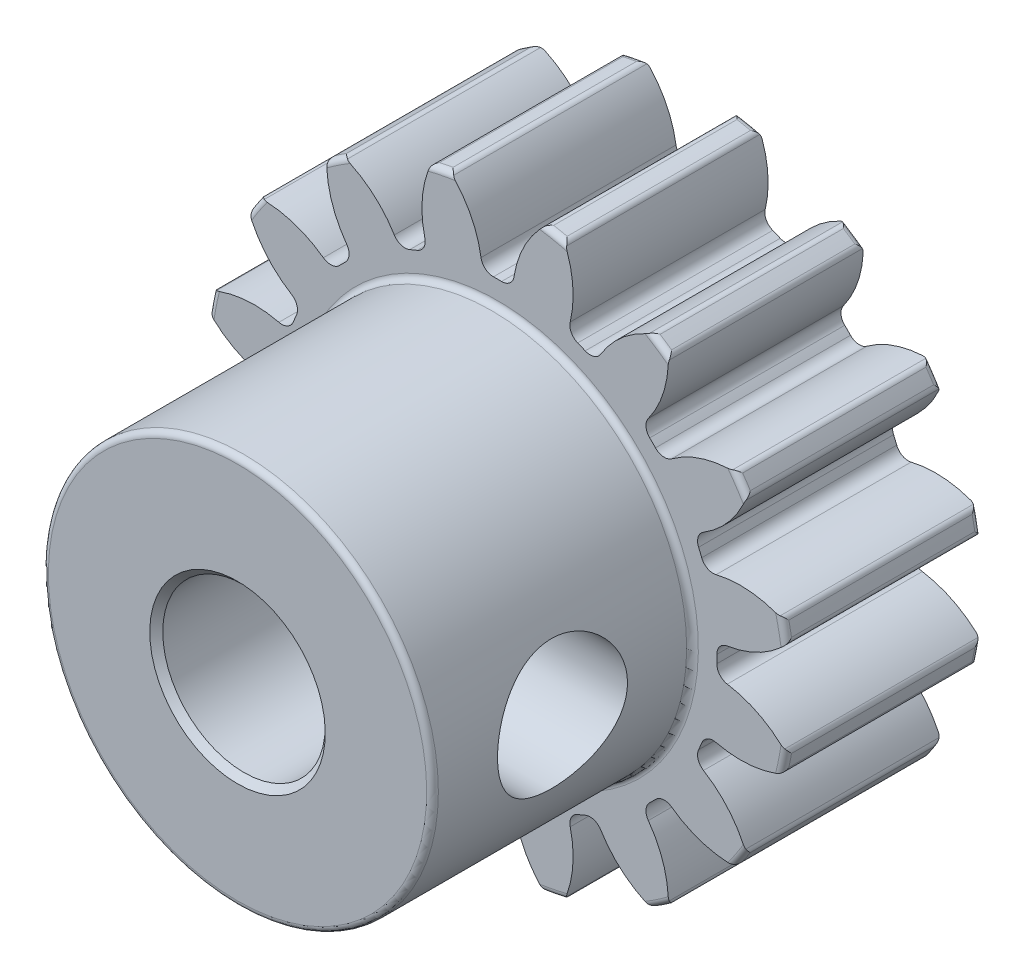
from build123d import *
from OCP.BRepAlgoAPI import BRepAlgoAPI_Cut
from OCP.TopTools import TopTools_ListOfShape

# Parameters (mm, degrees)
FILLET2_R               = 0.18
CUT_EXTRUDE2_DEPTH      = 16.033296498
FILLET3_R               = 0.380000002
FILLET4_R               = 0.190000001
CIRPATTERN1_DEPTH       = 6
CUT_EXTRUDE3_REACH      = 24.265
CUT_EXTRUDE3_END_RADIUS = 2.5
SKETCH8_R               = 2
CHAMFER1_SIZE           = 0.2


with BuildPart() as part:
    # Sketch4 → Revolve1 (revolve)
    with BuildSketch(Plane(origin=(0, 0, 0), x_dir=(0, 0, -1), z_dir=(1, 0, 0))):
        Polygon((-14, 2.5), (-14, 6), (-6, 6), (-6, 9), (0, 9), (0, 2.5), align=None)
    revolve(axis=Axis((0, 0, 6), (0, 0, 1)))

    # Fillet2
    fillet2_edges = [part.edges().sort_by_distance(p)[0] for p in [
        (0, -9, 0),
        (0, -9, 6),
        (0, -6, 6),
        (0, -6, 14),
    ]]
    fillet(fillet2_edges, radius=FILLET2_R)

    # Sketch7 → Cut-Extrude2 (cut, through all)
    with BuildSketch(Plane.XY.offset(6)):
        with BuildLine():
            ThreePointArc((-1.449653973, 8.88248295), (0, 9), (1.449653973, 8.88248295))
            ThreePointArc((1.449653973, 8.88248295), (0.756020423, 7.901265339), (0.473194462, 6.733393352))
            ThreePointArc((0.473194462, 6.733393352), (0, 6.749999928), (-0.473194462, 6.733393352))
            ThreePointArc((-0.473194462, 6.733393352), (-0.756020423, 7.901265339), (-1.449653973, 8.88248295))
        make_face()
    extrude(amount=-CUT_EXTRUDE2_DEPTH, mode=Mode.SUBTRACT)

    # Fillet3
    fillet3_edges = [part.edges().sort_by_distance(p)[0] for p in [
        (-0.473194462, 6.733393352, 3),
        (0.473194462, 6.733393352, 3),
    ]]
    fillet(fillet3_edges, radius=FILLET3_R)

    # Fillet4
    # the kernel refuses this fillet: 0.190000001 mm, written as the material it takes off along each edge
    with BuildSketch(Plane(origin=(1.449653973, 8.88248295, 6.071651168), x_dir=(-0.7092939445034832, -0.7049128316967209, 0), z_dir=(0, 0, -1))) as fillet4_piece_1:
        with BuildLine():
            CenterArc((0.09767211, -0.189976499), FILLET4_R, 89.098803476, 55.621039851)
            ThreePointArc((-0.057432049, -0.08023726), (-0.028825988, -0.040039921), (0, 0))
            ThreePointArc((0, 0), (0.050330234, 0.000395826), (0.100660467, 0))
        make_face()
    extrude(amount=6.143302337, mode=Mode.SUBTRACT)
    with BuildSketch(Plane(origin=(-1.449653973, 8.88248295, 6.071651168), x_dir=(0.7092939445034688, -0.7049128316967355, 0), z_dir=(0, 0, -1))) as fillet4_piece_2:
        with BuildLine():
            CenterArc((0.09767211, 0.189976499), FILLET4_R, 215.280156673, 55.621039851)
            ThreePointArc((-0.057432049, 0.08023726), (-0.028825988, 0.040039921), (0, 0))
            ThreePointArc((0, 0), (0.050330234, -0.000395826), (0.100660467, 0))
        make_face()
    extrude(amount=6.143302337, mode=Mode.SUBTRACT)


with BuildPart() as cirpattern1_tool:
    # CirPattern1: read off the stored shape, not the designer's step
    # CirPattern1 outline → CirPattern1 (new body)
    with BuildSketch(Plane.XY):
        with BuildLine():
            ThreePointArc((-1.96369678, 8.783159736), (-3.444150891, 8.314915792), (-4.822088501, 7.599175119))
            ThreePointArc((-4.822088501, 7.599175119), (-4.735483087, 7.628139576), (-4.645367664, 7.613352829))
            ThreePointArc((-4.645367664, 7.613352829), (-3.810628001, 7.090159416), (-3.174596034, 6.337839677))
            ThreePointArc((-3.174596034, 6.337839677), (-2.964624221, 6.173250502), (-2.698200807, 6.18726203))
            ThreePointArc((-2.698200807, 6.18726203), (-2.583113141, 6.236186778), (-2.467138851, 6.282971026))
            ThreePointArc((-2.467138851, 6.282971026), (-2.268841401, 6.461453182), (-2.236751031, 6.726307797))
            ThreePointArc((-2.236751031, 6.726307797), (-2.318978902, 7.708020703), (-2.098682437, 8.668224389))
            ThreePointArc((-2.098682437, 8.668224389), (-2.045417019, 8.742401425), (-1.96369678, 8.783159736))
        make_face()
        with BuildLine():
            ThreePointArc((-5.175388978, 7.363107287), (-6.363961031, 6.363961031), (-7.363107287, 5.175388978))
            ThreePointArc((-7.363107287, 5.175388978), (-7.294178536, 5.235291104), (-7.205264098, 5.256115611))
            ThreePointArc((-7.205264098, 5.256115611), (-6.233847758, 5.092188963), (-5.358330541, 4.640535052))
            ThreePointArc((-5.358330541, 4.640535052), (-5.101356331, 4.568827215), (-4.860575171, 4.683728006))
            ThreePointArc((-4.860575171, 4.683728006), (-4.772970722, 4.772970722), (-4.683728006, 4.860575171))
            ThreePointArc((-4.683728006, 4.860575171), (-4.568827215, 5.101356331), (-4.640535052, 5.358330541))
            ThreePointArc((-4.640535052, 5.358330541), (-5.092188963, 6.233847758), (-5.256115611, 7.205264098))
            ThreePointArc((-5.256115611, 7.205264098), (-5.235291104, 7.294178536), (-5.175388978, 7.363107287))
        make_face()
        with BuildLine():
            ThreePointArc((-7.599175119, 4.822088501), (-8.314915792, 3.444150892), (-8.783159736, 1.96369678))
            ThreePointArc((-8.783159736, 1.96369678), (-8.742401425, 2.045417019), (-8.668224389, 2.098682437))
            ThreePointArc((-8.668224389, 2.098682437), (-7.708020703, 2.318978902), (-6.726307797, 2.236751031))
            ThreePointArc((-6.726307797, 2.236751031), (-6.461453182, 2.268841401), (-6.282971026, 2.467138851))
            ThreePointArc((-6.282971026, 2.467138851), (-6.236186778, 2.583113141), (-6.18726203, 2.698200807))
            ThreePointArc((-6.18726203, 2.698200807), (-6.173250502, 2.964624221), (-6.337839677, 3.174596034))
            ThreePointArc((-6.337839677, 3.174596034), (-7.090159416, 3.810628001), (-7.613352829, 4.645367664))
            ThreePointArc((-7.613352829, 4.645367664), (-7.628139576, 4.735483087), (-7.599175119, 4.822088501))
        make_face()
        with BuildLine():
            ThreePointArc((-8.866055735, 1.546950452), (-9, 0), (-8.866055735, -1.546950452))
            ThreePointArc((-8.866055735, -1.546950452), (-8.859672947, -1.455853265), (-8.811526095, -1.378256113))
            ThreePointArc((-8.811526095, -1.378256113), (-8.008717369, -0.807274675), (-7.070265665, -0.507558058))
            ThreePointArc((-7.070265665, -0.507558058), (-6.83785236, -0.376554949), (-6.748841498, -0.12504983))
            ThreePointArc((-6.748841498, -0.12504983), (-6.749999928, 0), (-6.748841498, 0.12504983))
            ThreePointArc((-6.748841498, 0.12504983), (-6.83785236, 0.376554949), (-7.070265665, 0.507558058))
            ThreePointArc((-7.070265665, 0.507558058), (-8.008717369, 0.807274675), (-8.811526095, 1.378256113))
            ThreePointArc((-8.811526095, 1.378256113), (-8.859672947, 1.455853265), (-8.866055735, 1.546950452))
        make_face()
        with BuildLine():
            ThreePointArc((-8.783159736, -1.96369678), (-8.314915792, -3.444150892), (-7.599175119, -4.822088501))
            ThreePointArc((-7.599175119, -4.822088501), (-7.628139576, -4.735483087), (-7.613352829, -4.645367664))
            ThreePointArc((-7.613352829, -4.645367664), (-7.090159416, -3.810628001), (-6.337839677, -3.174596034))
            ThreePointArc((-6.337839677, -3.174596034), (-6.173250502, -2.964624221), (-6.18726203, -2.698200807))
            ThreePointArc((-6.18726203, -2.698200807), (-6.236186778, -2.583113141), (-6.282971026, -2.467138851))
            ThreePointArc((-6.282971026, -2.467138851), (-6.461453182, -2.268841401), (-6.726307797, -2.236751031))
            ThreePointArc((-6.726307797, -2.236751031), (-7.708020703, -2.318978902), (-8.668224389, -2.098682437))
            ThreePointArc((-8.668224389, -2.098682437), (-8.742401425, -2.045417019), (-8.783159736, -1.96369678))
        make_face()
        with BuildLine():
            ThreePointArc((-7.363107287, -5.175388978), (-6.363961031, -6.363961031), (-5.175388978, -7.363107287))
            ThreePointArc((-5.175388978, -7.363107287), (-5.235291104, -7.294178536), (-5.256115611, -7.205264098))
            ThreePointArc((-5.256115611, -7.205264098), (-5.092188963, -6.233847758), (-4.640535052, -5.358330541))
            ThreePointArc((-4.640535052, -5.358330541), (-4.568827215, -5.101356331), (-4.683728006, -4.860575171))
            ThreePointArc((-4.683728006, -4.860575171), (-4.772970722, -4.772970722), (-4.860575171, -4.683728006))
            ThreePointArc((-4.860575171, -4.683728006), (-5.101356331, -4.568827215), (-5.358330541, -4.640535052))
            ThreePointArc((-5.358330541, -4.640535052), (-6.233847758, -5.092188963), (-7.205264098, -5.256115611))
            ThreePointArc((-7.205264098, -5.256115611), (-7.294178536, -5.235291104), (-7.363107287, -5.175388978))
        make_face()
        with BuildLine():
            ThreePointArc((-4.822088501, -7.599175119), (-3.444150892, -8.314915792), (-1.96369678, -8.783159736))
            ThreePointArc((-1.96369678, -8.783159736), (-2.045417019, -8.742401425), (-2.098682437, -8.668224389))
            ThreePointArc((-2.098682437, -8.668224389), (-2.318978902, -7.708020703), (-2.236751031, -6.726307797))
            ThreePointArc((-2.236751031, -6.726307797), (-2.268841401, -6.461453182), (-2.467138851, -6.282971026))
            ThreePointArc((-2.467138851, -6.282971026), (-2.583113141, -6.236186778), (-2.698200807, -6.18726203))
            ThreePointArc((-2.698200807, -6.18726203), (-2.964624221, -6.173250502), (-3.174596034, -6.337839677))
            ThreePointArc((-3.174596034, -6.337839677), (-3.810628001, -7.090159416), (-4.645367664, -7.613352829))
            ThreePointArc((-4.645367664, -7.613352829), (-4.735483087, -7.628139576), (-4.822088501, -7.599175119))
        make_face()
        with BuildLine():
            ThreePointArc((-1.546950452, -8.866055735), (0, -9), (1.546950452, -8.866055735))
            ThreePointArc((1.546950452, -8.866055735), (1.455853265, -8.859672947), (1.378256113, -8.811526095))
            ThreePointArc((1.378256113, -8.811526095), (0.807274675, -8.008717369), (0.507558058, -7.070265665))
            ThreePointArc((0.507558058, -7.070265665), (0.376554949, -6.83785236), (0.12504983, -6.748841498))
            ThreePointArc((0.12504983, -6.748841498), (0, -6.749999928), (-0.12504983, -6.748841498))
            ThreePointArc((-0.12504983, -6.748841498), (-0.376554949, -6.83785236), (-0.507558058, -7.070265665))
            ThreePointArc((-0.507558058, -7.070265665), (-0.807274675, -8.008717369), (-1.378256113, -8.811526095))
            ThreePointArc((-1.378256113, -8.811526095), (-1.455853265, -8.859672947), (-1.546950452, -8.866055735))
        make_face()
        with BuildLine():
            ThreePointArc((1.96369678, -8.783159736), (3.444150892, -8.314915792), (4.822088501, -7.599175119))
            ThreePointArc((4.822088501, -7.599175119), (4.735483087, -7.628139576), (4.645367664, -7.613352829))
            ThreePointArc((4.645367664, -7.613352829), (3.810628001, -7.090159416), (3.174596034, -6.337839677))
            ThreePointArc((3.174596034, -6.337839677), (2.964624221, -6.173250502), (2.698200807, -6.18726203))
            ThreePointArc((2.698200807, -6.18726203), (2.583113141, -6.236186778), (2.467138851, -6.282971026))
            ThreePointArc((2.467138851, -6.282971026), (2.268841401, -6.461453182), (2.236751031, -6.726307797))
            ThreePointArc((2.236751031, -6.726307797), (2.318978902, -7.708020703), (2.098682437, -8.668224389))
            ThreePointArc((2.098682437, -8.668224389), (2.045417019, -8.742401425), (1.96369678, -8.783159736))
        make_face()
        with BuildLine():
            ThreePointArc((5.175388978, -7.363107287), (6.363961031, -6.363961031), (7.363107287, -5.175388978))
            ThreePointArc((7.363107287, -5.175388978), (7.294178536, -5.235291104), (7.205264098, -5.256115611))
            ThreePointArc((7.205264098, -5.256115611), (6.233847758, -5.092188963), (5.358330541, -4.640535052))
            ThreePointArc((5.358330541, -4.640535052), (5.101356331, -4.568827215), (4.860575171, -4.683728006))
            ThreePointArc((4.860575171, -4.683728006), (4.772970722, -4.772970722), (4.683728006, -4.860575171))
            ThreePointArc((4.683728006, -4.860575171), (4.568827215, -5.101356331), (4.640535052, -5.358330541))
            ThreePointArc((4.640535052, -5.358330541), (5.092188963, -6.233847758), (5.256115611, -7.205264098))
            ThreePointArc((5.256115611, -7.205264098), (5.235291104, -7.294178536), (5.175388978, -7.363107287))
        make_face()
        with BuildLine():
            ThreePointArc((7.599175119, -4.822088501), (8.314915792, -3.444150892), (8.783159736, -1.96369678))
            ThreePointArc((8.783159736, -1.96369678), (8.742401425, -2.045417019), (8.668224389, -2.098682437))
            ThreePointArc((8.668224389, -2.098682437), (7.708020703, -2.318978902), (6.726307797, -2.236751031))
            ThreePointArc((6.726307797, -2.236751031), (6.461453182, -2.268841401), (6.282971026, -2.467138851))
            ThreePointArc((6.282971026, -2.467138851), (6.236186778, -2.583113141), (6.18726203, -2.698200807))
            ThreePointArc((6.18726203, -2.698200807), (6.173250502, -2.964624221), (6.337839677, -3.174596034))
            ThreePointArc((6.337839677, -3.174596034), (7.090159416, -3.810628001), (7.613352829, -4.645367664))
            ThreePointArc((7.613352829, -4.645367664), (7.628139576, -4.735483087), (7.599175119, -4.822088501))
        make_face()
        with BuildLine():
            ThreePointArc((8.866055735, -1.546950452), (9, 0), (8.866055735, 1.546950452))
            ThreePointArc((8.866055735, 1.546950452), (8.859672947, 1.455853265), (8.811526095, 1.378256113))
            ThreePointArc((8.811526095, 1.378256113), (8.008717369, 0.807274675), (7.070265665, 0.507558058))
            ThreePointArc((7.070265665, 0.507558058), (6.83785236, 0.376554949), (6.748841498, 0.12504983))
            ThreePointArc((6.748841498, 0.12504983), (6.749999928, 0), (6.748841498, -0.12504983))
            ThreePointArc((6.748841498, -0.12504983), (6.83785236, -0.376554949), (7.070265665, -0.507558058))
            ThreePointArc((7.070265665, -0.507558058), (8.008717369, -0.807274675), (8.811526095, -1.378256113))
            ThreePointArc((8.811526095, -1.378256113), (8.859672947, -1.455853265), (8.866055735, -1.546950452))
        make_face()
        with BuildLine():
            ThreePointArc((8.783159736, 1.96369678), (8.314915792, 3.444150892), (7.599175119, 4.822088501))
            ThreePointArc((7.599175119, 4.822088501), (7.628139576, 4.735483087), (7.613352829, 4.645367664))
            ThreePointArc((7.613352829, 4.645367664), (7.090159416, 3.810628001), (6.337839677, 3.174596034))
            ThreePointArc((6.337839677, 3.174596034), (6.173250502, 2.964624221), (6.18726203, 2.698200807))
            ThreePointArc((6.18726203, 2.698200807), (6.236186778, 2.583113141), (6.282971026, 2.467138851))
            ThreePointArc((6.282971026, 2.467138851), (6.461453182, 2.268841401), (6.726307797, 2.236751031))
            ThreePointArc((6.726307797, 2.236751031), (7.708020703, 2.318978902), (8.668224389, 2.098682437))
            ThreePointArc((8.668224389, 2.098682437), (8.742401425, 2.045417019), (8.783159736, 1.96369678))
        make_face()
        with BuildLine():
            ThreePointArc((7.363107287, 5.175388978), (6.363961031, 6.363961031), (5.175388978, 7.363107287))
            ThreePointArc((5.175388978, 7.363107287), (5.235291104, 7.294178536), (5.256115611, 7.205264098))
            ThreePointArc((5.256115611, 7.205264098), (5.092188963, 6.233847758), (4.640535052, 5.358330541))
            ThreePointArc((4.640535052, 5.358330541), (4.568827215, 5.101356331), (4.683728006, 4.860575171))
            ThreePointArc((4.683728006, 4.860575171), (4.772970722, 4.772970722), (4.860575171, 4.683728006))
            ThreePointArc((4.860575171, 4.683728006), (5.101356331, 4.568827215), (5.358330541, 4.640535052))
            ThreePointArc((5.358330541, 4.640535052), (6.233847758, 5.092188963), (7.205264098, 5.256115611))
            ThreePointArc((7.205264098, 5.256115611), (7.294178536, 5.235291104), (7.363107287, 5.175388978))
        make_face()
        with BuildLine():
            ThreePointArc((2.467138851, 6.282971026), (2.583113141, 6.236186778), (2.698200807, 6.18726203))
            ThreePointArc((2.698200807, 6.18726203), (2.964624221, 6.173250502), (3.174596034, 6.337839677))
            ThreePointArc((3.174596034, 6.337839677), (3.810628001, 7.090159416), (4.645367664, 7.613352829))
            ThreePointArc((4.645367664, 7.613352829), (4.735483087, 7.628139576), (4.822088501, 7.599175119))
            ThreePointArc((4.822088501, 7.599175119), (3.444150891, 8.314915792), (1.96369678, 8.783159736))
            ThreePointArc((1.96369678, 8.783159736), (2.045417019, 8.742401425), (2.098682437, 8.668224389))
            ThreePointArc((2.098682437, 8.668224389), (2.318978902, 7.708020703), (2.236751031, 6.726307797))
            ThreePointArc((2.236751031, 6.726307797), (2.268841401, 6.461453182), (2.467138851, 6.282971026))
        make_face()
    extrude(amount=CIRPATTERN1_DEPTH)


with BuildPart() as part_1:
    add(part.part)

    # CirPattern1: cut by cirpattern1_tool, with a tolerance
    cirpattern1_stock = TopTools_ListOfShape()
    cirpattern1_stock.Append(part_1.part.wrapped)
    cirpattern1_tools = TopTools_ListOfShape()
    cirpattern1_tools.Append(cirpattern1_tool.part.wrapped)
    cirpattern1_cut = BRepAlgoAPI_Cut()
    cirpattern1_cut.SetArguments(cirpattern1_stock)
    cirpattern1_cut.SetTools(cirpattern1_tools)
    cirpattern1_cut.SetFuzzyValue(0.00001)
    cirpattern1_cut.Build()
    add(Compound.cast(cirpattern1_cut.Shape()).solids(), mode=Mode.REPLACE)

    # Cut-Extrude3: up to this cylinder (the profile starts outside it)
    cut_extrude3_end = Plane(origin=(0, 0, 10), z_dir=(0, 0, -1)) * Cylinder(CUT_EXTRUDE3_END_RADIUS, 54.53, mode=Mode.PRIVATE)
    # Sketch8 → Cut-Extrude3 (cut, up to the surface)
    with BuildSketch(Plane(origin=(6, 0, 0), x_dir=(0, 0, -1), z_dir=(1, 0, 0)), mode=Mode.PRIVATE) as cut_extrude3_sk1:
        with Locations((-10, 0)):
            Circle(SKETCH8_R)
    cut_extrude3_tool1 = extrude(cut_extrude3_sk1.sketch, amount=-CUT_EXTRUDE3_REACH, mode=Mode.PRIVATE) - cut_extrude3_end
    add(cut_extrude3_tool1.solids().sort_by_distance((6, 0, 10))[0], mode=Mode.SUBTRACT)

    # Chamfer1
    chamfer1_edges = [part_1.edges().sort_by_distance(p)[0] for p in [
        (0, -2.5, 0),
        (0, -2.5, 14),
    ]]
    chamfer(chamfer1_edges, length=CHAMFER1_SIZE)


solid = part_1.part
